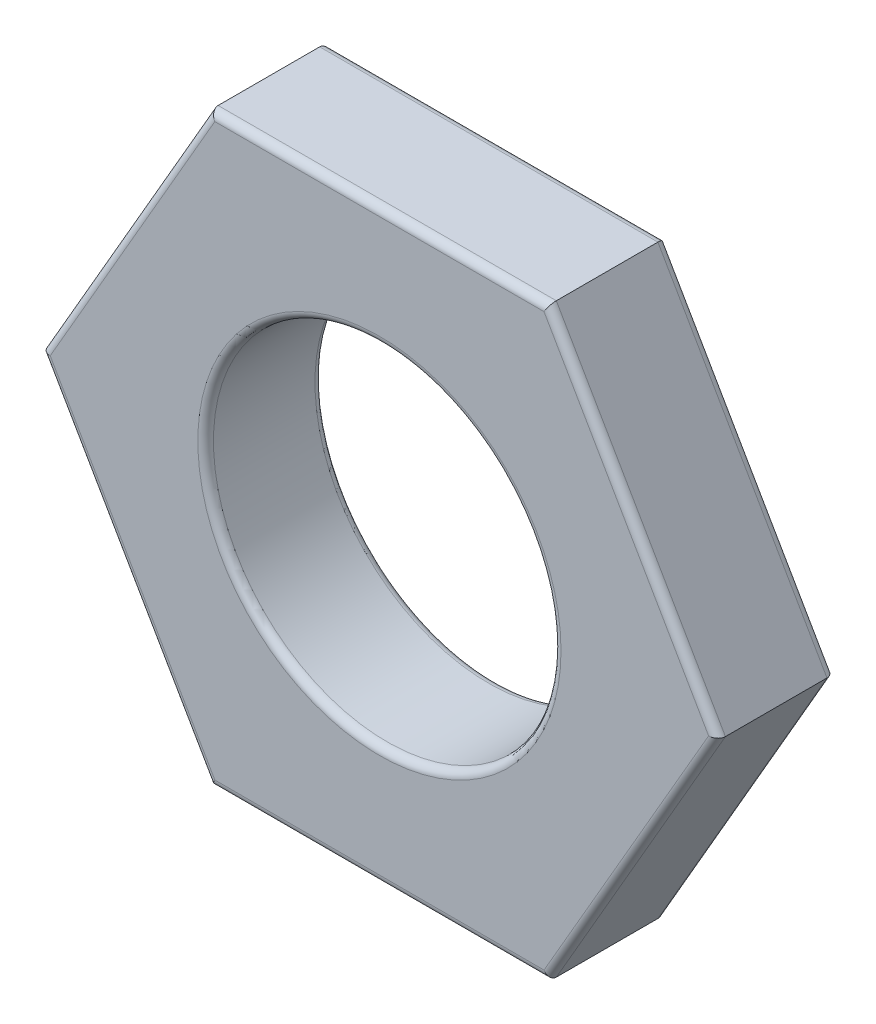
from build123d import *

# Parameters (mm, degrees)
EXTRUDE_1_DEPTH     = 15
SKETCH_2_R          = 22.25
CUT_EXTRUDE_2_DEPTH = 60.213596412
FILLET_1_R          = 1


with BuildPart() as part:
    # 草图1 → 拉伸1 (new body)
    with BuildSketch(Plane.XY):
        Polygon((21.650635095, -37.5), (43.301270189, 0), (21.650635095, 37.5), (-21.650635095, 37.5), (-43.301270189, 0), (-21.650635095, -37.5), align=None)
    extrude(amount=EXTRUDE_1_DEPTH)

    # 草图2 → 拉伸2 (cut, through all)
    with BuildSketch(Plane.XY.offset(15)):
        Circle(SKETCH_2_R)
    extrude(amount=-CUT_EXTRUDE_2_DEPTH, mode=Mode.SUBTRACT)

    # 圆角1
    fillet_1_edges = [part.edges().sort_by_distance(p)[0] for p in [
        (-22.25, 0, 0),
        (-22.25, 0, 15),
        (-32.475952642, -18.75, 15),
        (0, -37.5, 15),
        (32.475952642, -18.75, 15),
        (32.475952642, 18.75, 15),
        (0, 37.5, 15),
        (-32.475952642, 18.75, 15),
        (0, 37.5, 0),
        (32.475952642, 18.75, 0),
        (32.475952642, -18.75, 0),
        (0, -37.5, 0),
        (-32.475952642, -18.75, 0),
        (-32.475952642, 18.75, 0),
    ]]
    fillet(fillet_1_edges, radius=FILLET_1_R)


solid = part.part
